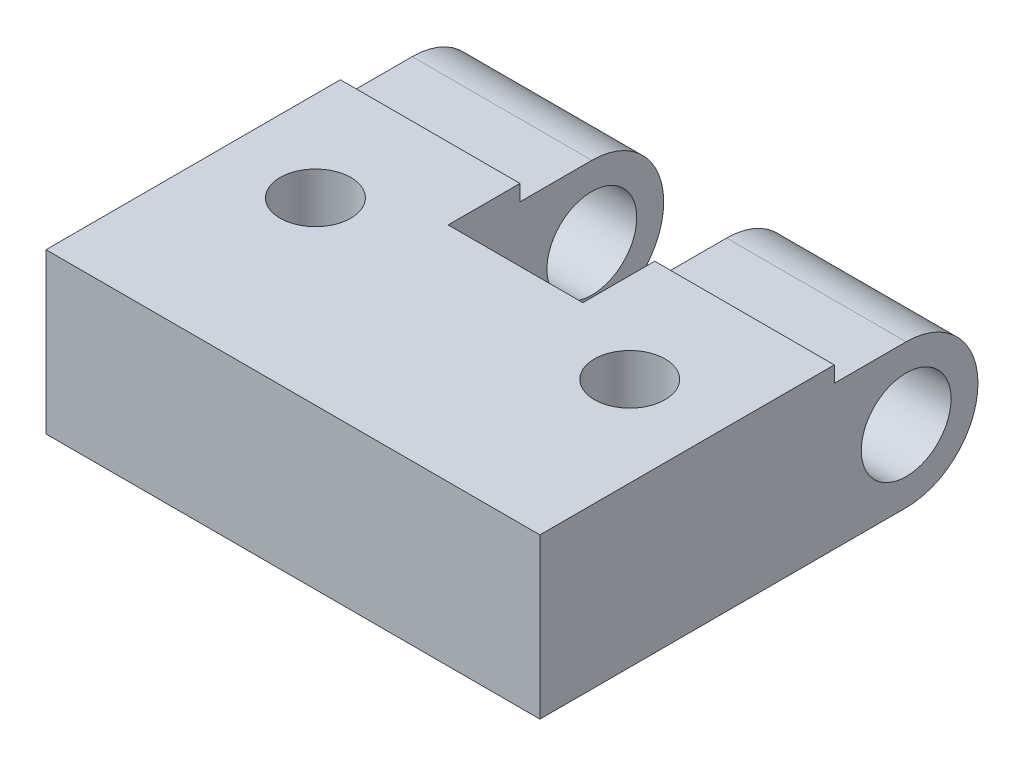
from build123d import *
from build123d.topology import SkipClean

# Parameters (mm, degrees)
SKETCH2_R               = 1.5875
BOSS_EXTRUDE1_DEPTH     = 6.35
CUT_EXTRUDE1_DEPTH      = 10
BOSS_EXTRUDE2_DEPTH     = 4.7625
BOSS_EXTRUDE3_DEPTH     = 0.56250002
CUT_EXTRUDE2_DEPTH      = 21.353004305
CUT_EXTRUDE2_DEPTH_BACK = 21.353004305
SKETCH7_R               = 1.25


with BuildPart() as part:
    # Sketch2 → Boss-Extrude1 (new body)
    with BuildSketch(Plane(origin=(0, 0, 0), x_dir=(0, 0, -1), z_dir=(1, 0, 0))):
        with BuildLine():
            Line((6.597804878, 5.08), (-6.35, 5.08))
            Line((-6.35, 5.08), (-6.35, 0))
            Line((-6.35, 0), (6.597804878, 0))
            ThreePointArc((6.597804878, 0), (9.137804878, 2.54), (6.597804878, 5.08))
        make_face()
        with Locations((6.597804878, 2.54)):
            Circle(SKETCH2_R, mode=Mode.SUBTRACT)
    boss_extrude1 = extrude(amount=BOSS_EXTRUDE1_DEPTH)

    # Sketch3 → Cut-Extrude1 (cut)
    with BuildSketch(Plane(origin=(0, 5.08, 0), x_dir=(1, 0, 0), z_dir=(0, 1, 0))):
        with BuildLine():
            ThreePointArc((3.175, -1.25), (4.058883476, -0.883883476), (4.425, 0))
            ThreePointArc((4.425, 0), (2.291116524, 0.883883476), (3.175, -1.25))
        make_face()
    cut_extrude1 = extrude(amount=-CUT_EXTRUDE1_DEPTH, mode=Mode.SUBTRACT)

    # Sketch4 → Boss-Extrude2 (add)
    with BuildSketch(Plane(origin=(6.35, 0, 0), x_dir=(0, 0, -1), z_dir=(1, 0, 0))):
        Polygon((-6.35, 0), (1.517804878, 0), (1.517804878, 2.54), (1.517804878, 5.08), (-6.35, 5.08), align=None)
    extrude(amount=BOSS_EXTRUDE2_DEPTH)

    # Mirror1: Boss-Extrude1, Cut-Extrude1 across plane
    add(boss_extrude1.mirror(Plane(origin=(8.73125, 0, 0), x_dir=(0, 0, 1), z_dir=(1, 0, 0))))
    add(cut_extrude1.mirror(Plane(origin=(8.73125, 0, 0), x_dir=(0, 0, 1), z_dir=(1, 0, 0))), mode=Mode.SUBTRACT)

    # Sketch6 → Boss-Extrude3 (add)
    with BuildSketch(Plane(origin=(0, 5.08, 0), x_dir=(1, 0, 0), z_dir=(0, 1, 0))):
        Polygon((6.35, 4.057804878), (0, 4.057804878), (0, -6.35), (17.4625, -6.35), (17.4625, 4.057804878), (11.1125, 4.057804878), (11.1125, 1.517804878), (6.35, 1.517804878), align=None)
    extrude(amount=BOSS_EXTRUDE3_DEPTH)

    # Sketch7 → Cut-Extrude2 (cut, two sides: drawn at the far end of the back side and taken through both)
    with SkipClean():  # the faces are left unmerged after this step: merging them gives an invalid solid
        with BuildSketch(Plane.XZ.offset(-5.08).offset(-CUT_EXTRUDE2_DEPTH_BACK)):
            with Locations((14.2875, 0)):
                Circle(SKETCH7_R)
            with Locations((3.175, 0)):
                Circle(SKETCH7_R)
        extrude(amount=CUT_EXTRUDE2_DEPTH + CUT_EXTRUDE2_DEPTH_BACK, mode=Mode.SUBTRACT)


solid = part.part
